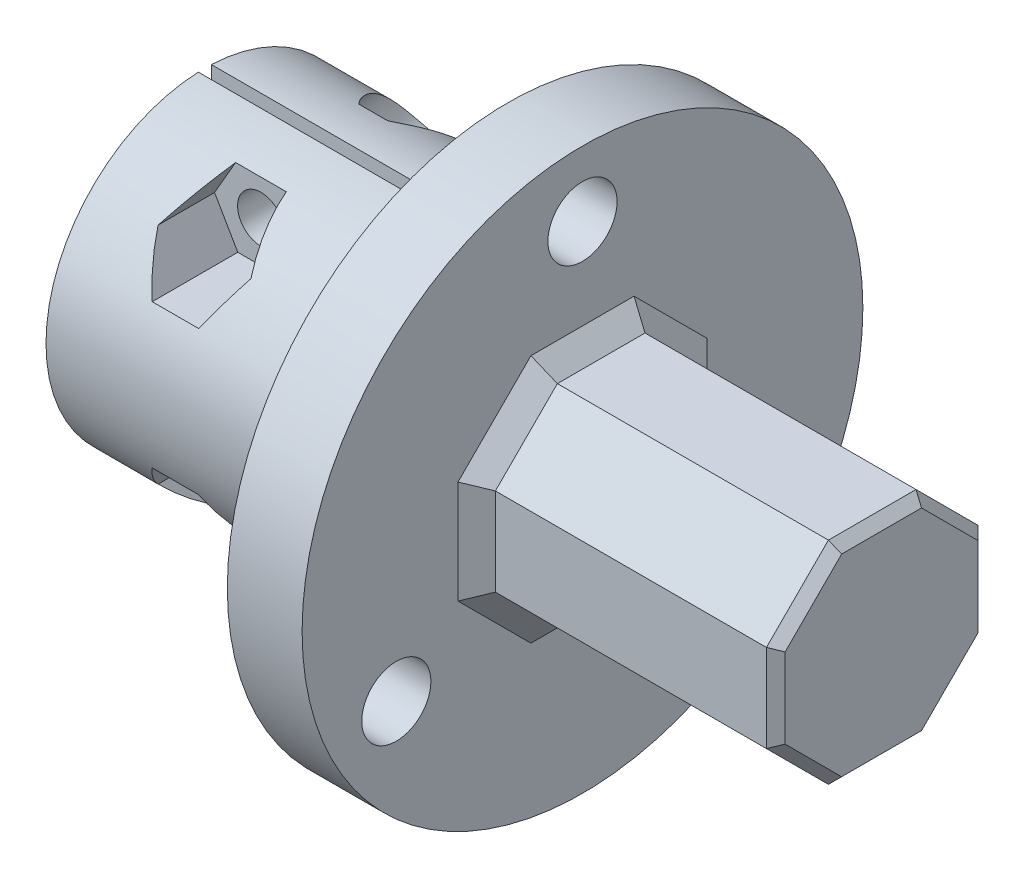
from build123d import *

# Parameters (mm, degrees)
SKETCH1_R               = 8.5
BOSS_EXTRUDE1_DEPTH     = 16.2
SKETCH4_W               = 0.7
SKETCH4_H               = 17
CUT_EXTRUDE2_DEPTH      = 21.172753902
SKETCH5_R               = 15
BOSS_EXTRUDE2_DEPTH     = 4
BOSS_EXTRUDE3_DEPTH     = 16
SKETCH7_R               = 1.85
CUT_EXTRUDE3_DEPTH      = 30.292319813
CHAMFER1_SIZE           = 0.5
CUT_EXTRUDE4_DEPTH      = 42.957597643
CUT_EXTRUDE4_DEPTH_BACK = 42.957597643
SKETCH8_R               = 1.25
CUT_EXTRUDE5_DEPTH      = 44.121224472
SKETCH10_R              = 2.1
CUT_EXTRUDE6_DEPTH      = 44.121224472
FILLET1_R               = 0.5
CHAMFER2_SIZE           = 1


with BuildPart() as part:
    # Sketch1 → Boss-Extrude1 (new body)
    with BuildSketch(Plane(origin=(0, 0, 0), x_dir=(0, 0, -1), z_dir=(1, 0, 0))):
        Circle(SKETCH1_R)
        with BuildLine():
            Line((2.4, 1.882153022), (2.4, -1.882153022))
            ThreePointArc((2.4, -1.882153022), (-3.05, 0), (2.4, 1.882153022))
        make_face(mode=Mode.SUBTRACT)
    extrude(amount=BOSS_EXTRUDE1_DEPTH)

    # Sketch4 → Cut-Extrude2 (cut, through all)
    with BuildSketch(Plane.ZY):
        Rectangle(SKETCH4_W, SKETCH4_H)
    extrude(amount=-CUT_EXTRUDE2_DEPTH, mode=Mode.SUBTRACT)


with BuildPart() as cut_extrude2_piece_1:
    # of the separate pieces the step leaves, piece 1, a body of its own (cut_extrude2_pieces)
    add(part.part.solids().sort_by_distance((0, -8.492791061, -0.35))[0])



with BuildPart() as cut_extrude2_piece_2:
    # of the separate pieces the step leaves, piece 2, a body of its own (cut_extrude2_pieces)
    add(part.part.solids().sort_by_distance((0, 3.029851482, 0.35))[0])


with BuildPart() as cut_extrude2_piece_1_1:
    add(cut_extrude2_piece_1.part)

    add(cut_extrude2_piece_2.part)  # Boss-Extrude2 merges Cut-Extrude2 piece 2
    # Sketch5 → Boss-Extrude2 (add)
    with BuildSketch(Plane(origin=(16.2, 0, 0), x_dir=(0, 0, -1), z_dir=(1, 0, 0))):
        Circle(SKETCH5_R)
    extrude(amount=BOSS_EXTRUDE2_DEPTH)

    # Sketch6 → Boss-Extrude3 (add)
    with BuildSketch(Plane(origin=(20.2, 0, 0), x_dir=(0, 0, -1), z_dir=(1, 0, 0))):
        Polygon((2.343936023, 5.658762137), (-2.343936023, 5.658762137), (-5.658762137, 2.343936023), (-5.658762137, -2.343936023), (-2.343936023, -5.658762137), (2.343936023, -5.658762137), (5.658762137, -2.343936023), (5.658762137, 2.343936023), align=None)
    extrude(amount=BOSS_EXTRUDE3_DEPTH)

    # Sketch7 → Cut-Extrude3 (cut, through all)
    with BuildSketch(Plane(origin=(20.2, 0, 0), x_dir=(0, 0, -1), z_dir=(1, 0, 0))):
        with Locations((0, 11.5)):
            Circle(SKETCH7_R)
        with Locations((-9.959292144, -5.75)):
            Circle(SKETCH7_R)
        with Locations((9.959292144, -5.75)):
            Circle(SKETCH7_R)
    extrude(amount=-CUT_EXTRUDE3_DEPTH, mode=Mode.SUBTRACT)

    # Chamfer1
    chamfer1_edges = [cut_extrude2_piece_1_1.edges().sort_by_distance(p)[0] for p in [
        (36.2, 0, -5.658762137),
        (36.2, -4.00134908, -4.00134908),
        (36.2, -5.658762137, 0),
        (36.2, -4.00134908, 4.00134908),
        (36.2, 0, 5.658762137),
        (36.2, 4.00134908, 4.00134908),
        (36.2, 5.658762137, 0),
        (36.2, 4.00134908, -4.00134908),
    ]]
    chamfer(chamfer1_edges, length=CHAMFER1_SIZE)

    # Sketch8 → Cut-Extrude4 (cut, two sides: drawn at the far end of the back side and taken through both)
    with BuildSketch(Plane.XY.offset(-CUT_EXTRUDE4_DEPTH_BACK)):
        with Locations((6, 6)):
            Circle(SKETCH8_R)
        with Locations((6, -6)):
            Circle(SKETCH8_R)
    extrude(amount=CUT_EXTRUDE4_DEPTH + CUT_EXTRUDE4_DEPTH_BACK, mode=Mode.SUBTRACT)

    # Sketch9 → Cut-Extrude5 (cut, through all)
    with BuildSketch(Plane.XY.offset(3)):
        Polygon((7.241303079, 3.85), (8.482606158, 6), (7.241303079, 8.15), (4.758696921, 8.15), (3.517393842, 6), (4.758696921, 3.85), align=None)
        Polygon((7.241303079, -8.15), (8.482606158, -6), (7.241303079, -3.85), (4.758696921, -3.85), (3.517393842, -6), (4.758696921, -8.15), align=None)
    extrude(amount=CUT_EXTRUDE5_DEPTH, mode=Mode.SUBTRACT)

    # Sketch10 → Cut-Extrude6 (cut, through all)
    with BuildSketch(Plane.XY.offset(-3)):
        with Locations((6, 6)):
            Circle(SKETCH10_R)
        with Locations((6, -6)):
            Circle(SKETCH10_R)
    extrude(amount=-CUT_EXTRUDE6_DEPTH, mode=Mode.SUBTRACT)

    # Fillet1
    fillet1_edges = [cut_extrude2_piece_1_1.edges().sort_by_distance(p)[0] for p in [
        (16.2, 0, 8.5),
        (16.2, 0, -8.5),
    ]]
    fillet(fillet1_edges, radius=FILLET1_R)

    # Chamfer2
    chamfer2_edges = [cut_extrude2_piece_1_1.edges().sort_by_distance(p)[0] for p in [
        (20.2, 4.00134908, 4.00134908),
        (20.2, 5.658762137, 0),
        (20.2, 4.00134908, -4.00134908),
        (20.2, 0, -5.658762137),
        (20.2, -4.00134908, -4.00134908),
        (20.2, -5.658762137, 0),
        (20.2, 0, 5.658762137),
        (20.2, -4.00134908, 4.00134908),
    ]]
    chamfer(chamfer2_edges, length=CHAMFER2_SIZE)


solid = cut_extrude2_piece_1_1.part
